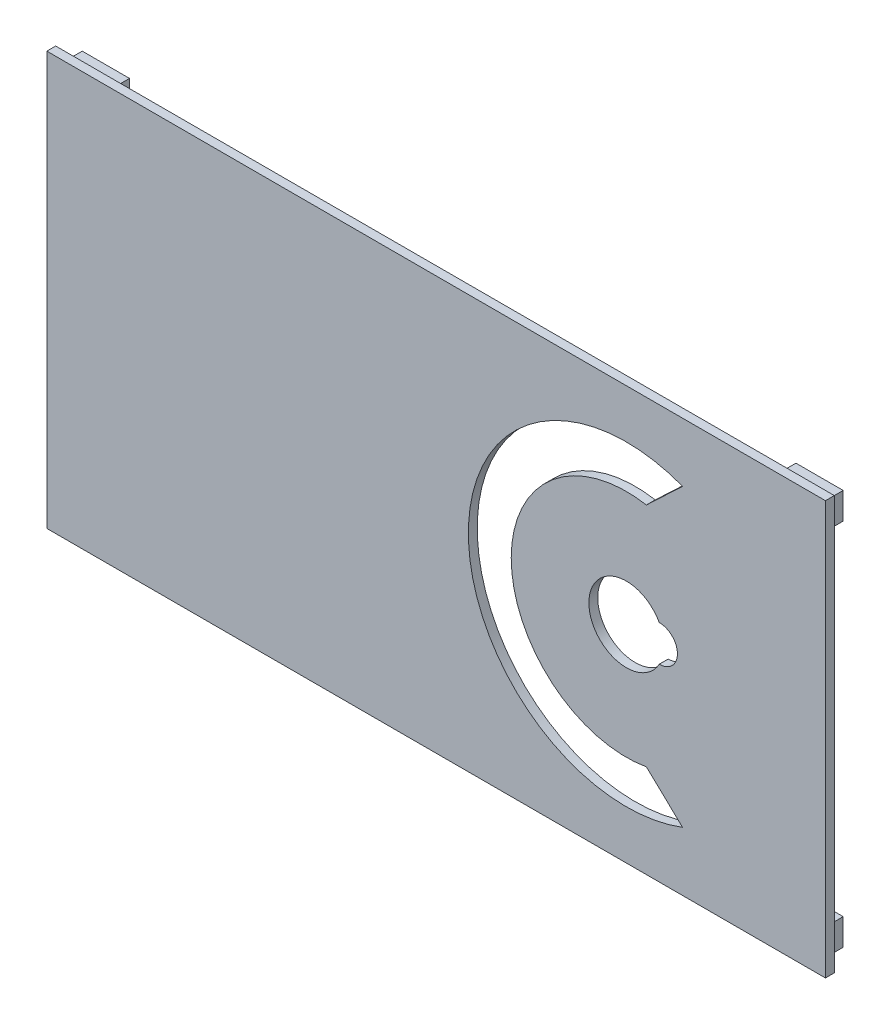
from build123d import *

# Parameters (mm, degrees)
SKETCH1_W                 = 131.85
SKETCH1_H                 = 70
BOSS_EXTRUDE1_DEPTH       = 1.5
CUT_EXTRUDE1_REACH        = 137.268
SKETCH4_W                 = 8
SKETCH4_H                 = 4.5
SKETCH4_W_2               = 5
SKETCH4_H_2               = 1.5
BOSS_EXTRUDE2_DEPTH       = 3
MIRROR2_COPY_1_SKETCH_W   = 8
MIRROR2_COPY_1_SKETCH_H   = 4.5
MIRROR2_COPY_1_SKETCH_W_2 = 5
MIRROR2_COPY_1_SKETCH_H_2 = 1.5
MIRROR2_COPY_1_DEPTH      = 3
CUT_EXTRUDE2_REACH        = 137.335


with BuildPart() as part:
    # Sketch1 → Boss-Extrude1 (new body)
    with BuildSketch(Plane.XY):
        with Locations((55.175, 25.25)):
            Rectangle(SKETCH1_W, SKETCH1_H)
    extrude(amount=BOSS_EXTRUDE1_DEPTH)

    # Sketch2 → Cut-Extrude1 (cut, up to next)
    with BuildSketch(Plane.XY.offset(1.5), mode=Mode.PRIVATE) as cut_extrude1_sk1:
        with BuildLine():
            Line((92.957060126, 22.2), (92.9875, 22.2))
            ThreePointArc((92.9875, 22.2), (96.0375, 25.25), (92.9875, 28.3))
            Line((92.9875, 28.3), (92.957060126, 28.3))
            ThreePointArc((92.957060126, 28.3), (81.0375, 25.25), (92.957060126, 22.2))
        make_face()
    cut_extrude1_tool1 = extrude(cut_extrude1_sk1.sketch, amount=-CUT_EXTRUDE1_REACH, mode=Mode.PRIVATE) & part.part
    add(cut_extrude1_tool1.solids().sort_by_distance((87.98685, 25.25, 1.5))[0], mode=Mode.SUBTRACT)

    # Sketch4 → Boss-Extrude2 (add)
    with BuildSketch(Plane(origin=(0, 0, 0), x_dir=(-1, 0, 0), z_dir=(0, 0, -1))):
        with Locations((-115.6, 56.5)):
            Rectangle(SKETCH4_W, SKETCH4_H)
        with Locations((-115.6, 56.5)):
            Rectangle(SKETCH4_W_2, SKETCH4_H_2, mode=Mode.SUBTRACT)
    boss_extrude2 = extrude(amount=BOSS_EXTRUDE2_DEPTH)

    # Mirror1: Boss-Extrude2 across plane
    add(boss_extrude2.mirror(Plane.ZX.offset(25.25)))

    # Mirror2: Boss-Extrude2 across plane
    add(boss_extrude2.mirror(Plane(origin=(55.175, 0, 0), x_dir=(0, 0, 1), z_dir=(1, 0, 0))))

    # Mirror2 copy 1 sketch → Mirror2 copy 1 (add)
    with BuildSketch(Plane(origin=(110.35, 50.5, 0), x_dir=(1, 0, 0), z_dir=(0, 0, -1))):
        with Locations((-115.6, 56.5)):
            Rectangle(MIRROR2_COPY_1_SKETCH_W, MIRROR2_COPY_1_SKETCH_H)
        with Locations((-115.6, 56.5)):
            Rectangle(MIRROR2_COPY_1_SKETCH_W_2, MIRROR2_COPY_1_SKETCH_H_2, mode=Mode.SUBTRACT)
    extrude(amount=MIRROR2_COPY_1_DEPTH)

    # Sketch5 → Cut-Extrude2 (cut, up to next)
    with BuildSketch(Plane.XY.offset(1.5), mode=Mode.PRIVATE) as cut_extrude2_sk1:
        with BuildLine():
            Line((90.774215328, 6.046350365), (96.908092333, 0.244034279))
            ThreePointArc((96.908092333, 0.244034279), (60.630444856, 25.25), (96.908092333, 50.255965721))
            Line((96.908092333, 50.255965721), (90.774215328, 44.453649635))
            ThreePointArc((90.774215328, 44.453649635), (67.8875, 25.25), (90.774215328, 6.046350365))
        make_face()
    cut_extrude2_tool1 = extrude(cut_extrude2_sk1.sketch, amount=-CUT_EXTRUDE2_REACH, mode=Mode.PRIVATE) & part.part
    add(cut_extrude2_tool1.solids().sort_by_distance((67.240984, 25.25, 1.5))[0], mode=Mode.SUBTRACT)


solid = part.part
